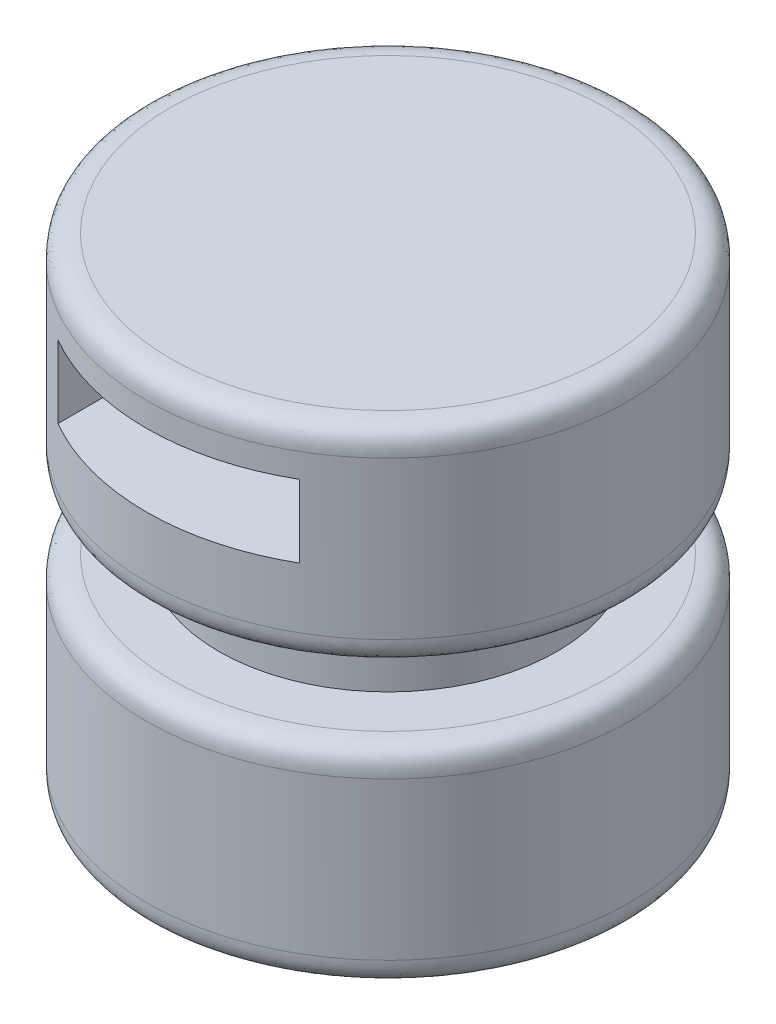
from build123d import *

# Parameters (mm, degrees)
SKETCH2_R               = 100
BOSS_EXTRUDE1_DEPTH     = 200
SKETCH3_W               = 30
SKETCH3_H               = 30
CUT_EXTRUDE1_DEPTH      = 245.948974278
CUT_EXTRUDE1_DEPTH_BACK = 245.948974278
SKETCH4_W               = 100
SKETCH4_H               = 30
FILLET2_SIZE            = 10


with BuildPart() as part:
    # Sketch2 → Boss-Extrude1 (new body)
    with BuildSketch(Plane(origin=(0, 0, 0), x_dir=(1, 0, 0), z_dir=(0, 1, 0))):
        with Locations(Location((0, 0, 0), (0, 0, 270))):
            Circle(SKETCH2_R)
    extrude(amount=BOSS_EXTRUDE1_DEPTH)

    # Sketch3 → Cut-Revolve1 (revolve, cut)
    with BuildSketch(Plane(origin=(0, 0, 0), x_dir=(0, 0, -1), z_dir=(1, 0, 0)), mode=Mode.PRIVATE) as cut_revolve1_sk:
        with Locations((85, 100)):
            Rectangle(SKETCH3_W, SKETCH3_H)
    revolve(cut_revolve1_sk.sketch.rotate(Axis((0, 200, 0), (0, -1, 0)), 180), axis=Axis((0, 200, 0), (0, -1, 0)), mode=Mode.SUBTRACT)

    # Sketch4 → Cut-Extrude1 (cut, two sides: drawn at the far end of the back side and taken through both)
    with BuildSketch(Plane.XY.offset(-CUT_EXTRUDE1_DEPTH_BACK)):
        with Locations((0, 165)):
            Rectangle(SKETCH4_W, SKETCH4_H)
    extrude(amount=CUT_EXTRUDE1_DEPTH + CUT_EXTRUDE1_DEPTH_BACK, mode=Mode.SUBTRACT)

    # Fillet2
    # a fillet whose section is not a circle: 10 mm, written as the material it takes off along each edge
    with BuildSketch(Plane(origin=(0, 0, 0), x_dir=(0, 0, 1), z_dir=(-1, 0, 0))) as fillet2_piece_1:
        with BuildLine():
            add(Edge.make_bspline([(100, FILLET2_SIZE), (100, FILLET2_SIZE * 0.831801948466), (100, FILLET2_SIZE * 0.663603896932), (100 - FILLET2_SIZE * 0.0716919198361, FILLET2_SIZE * 0.292893218813), (100 - FILLET2_SIZE * 0.292893218813, FILLET2_SIZE * 0.0716919198361), (100 - FILLET2_SIZE * 0.663603896932, 0), (100 - FILLET2_SIZE * 0.831801948466, 0), (100 - FILLET2_SIZE, 0)], knots=[0, 0, 0, 0, 0, 0, 0.5, 0.5, 1, 1, 1, 1, 1, 1], degree=5))
            Line((100 - FILLET2_SIZE, 0), (100, 0))
            Line((100, 0), (100, FILLET2_SIZE))
        make_face()
    revolve(axis=Axis((0, 0, 0), (0, 1, 0)), mode=Mode.SUBTRACT)
    with BuildSketch(Plane(origin=(0, 200, 0), x_dir=(0, 0, 1), z_dir=(-1, 0, 0))) as fillet2_piece_2:
        with BuildLine():
            add(Edge.make_bspline([(100, -FILLET2_SIZE), (100, -FILLET2_SIZE * 0.831801948466), (100, -FILLET2_SIZE * 0.663603896932), (100 - FILLET2_SIZE * 0.0716919198361, -FILLET2_SIZE * 0.292893218813), (100 - FILLET2_SIZE * 0.292893218813, -FILLET2_SIZE * 0.0716919198361), (100 - FILLET2_SIZE * 0.663603896932, 0), (100 - FILLET2_SIZE * 0.831801948466, 0), (100 - FILLET2_SIZE, 0)], knots=[0, 0, 0, 0, 0, 0, 0.5, 0.5, 1, 1, 1, 1, 1, 1], degree=5))
            Line((100 - FILLET2_SIZE, 0), (100, 0))
            Line((100, 0), (100, -FILLET2_SIZE))
        make_face()
    revolve(axis=Axis((0, 200, 0), (0, 1, 0)), mode=Mode.SUBTRACT)
    with BuildSketch(Plane(origin=(0, 85, 0), x_dir=(0, 0, 1), z_dir=(1, 0, 0))) as fillet2_piece_3:
        with BuildLine():
            add(Edge.make_bspline([(100, FILLET2_SIZE), (100, FILLET2_SIZE * 0.831801948466), (100, FILLET2_SIZE * 0.663603896932), (100 - FILLET2_SIZE * 0.0716919198361, FILLET2_SIZE * 0.292893218813), (100 - FILLET2_SIZE * 0.292893218813, FILLET2_SIZE * 0.0716919198361), (100 - FILLET2_SIZE * 0.663603896932, 0), (100 - FILLET2_SIZE * 0.831801948466, 0), (100 - FILLET2_SIZE, 0)], knots=[0, 0, 0, 0, 0, 0, 0.5, 0.5, 1, 1, 1, 1, 1, 1], degree=5))
            Line((100 - FILLET2_SIZE, 0), (100, 0))
            Line((100, 0), (100, FILLET2_SIZE))
        make_face()
    revolve(axis=Axis((0, 85, 0), (0, -1, 0)), mode=Mode.SUBTRACT)
    with BuildSketch(Plane(origin=(0, 115, 0), x_dir=(0, 0, 1), z_dir=(1, 0, 0))) as fillet2_piece_4:
        with BuildLine():
            add(Edge.make_bspline([(100 - FILLET2_SIZE, 0), (100 - FILLET2_SIZE * 0.831801948466, 0), (100 - FILLET2_SIZE * 0.663603896932, 0), (100 - FILLET2_SIZE * 0.292893218813, -FILLET2_SIZE * 0.0716919198361), (100 - FILLET2_SIZE * 0.0716919198361, -FILLET2_SIZE * 0.292893218813), (100, -FILLET2_SIZE * 0.663603896932), (100, -FILLET2_SIZE * 0.831801948466), (100, -FILLET2_SIZE)], knots=[0, 0, 0, 0, 0, 0, 0.5, 0.5, 1, 1, 1, 1, 1, 1], degree=5))
            Line((100, -FILLET2_SIZE), (100, 0))
            Line((100, 0), (100 - FILLET2_SIZE, 0))
        make_face()
    revolve(axis=Axis((0, 115, 0), (0, -1, 0)), mode=Mode.SUBTRACT)


solid = part.part
